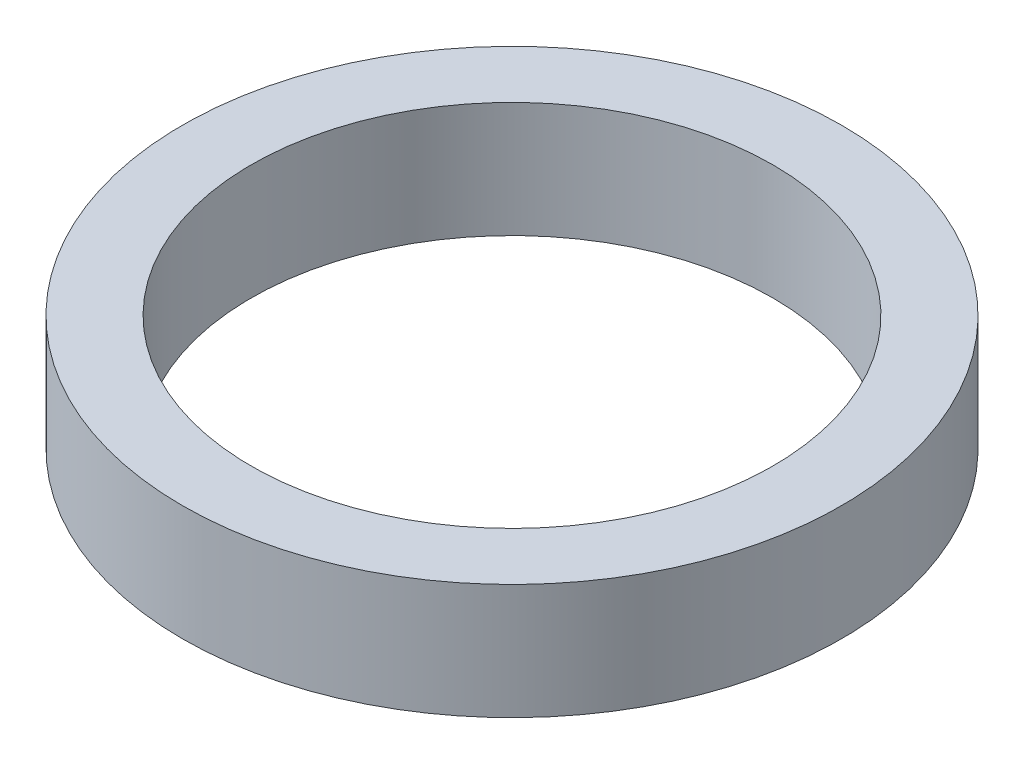
from build123d import *

# Parameters (mm, degrees)
SKETCH1_R           = 60
BOSS_EXTRUDE1_DEPTH = 21
SKETCH2_R           = 47.5
CUT_EXTRUDE1_DEPTH  = 88.412813706


with BuildPart() as part:
    # Sketch1 → Boss-Extrude1 (new body)
    with BuildSketch(Plane(origin=(0, 0, 0), x_dir=(1, 0, 0), z_dir=(0, 1, 0))):
        Circle(SKETCH1_R)
    extrude(amount=BOSS_EXTRUDE1_DEPTH)

    # Sketch2 → Cut-Extrude1 (cut, through all)
    with BuildSketch(Plane(origin=(0, 0, 0), x_dir=(1, 0, 0), z_dir=(0, 1, 0))):
        Circle(SKETCH2_R)
    extrude(amount=CUT_EXTRUDE1_DEPTH, mode=Mode.SUBTRACT)


solid = part.part
